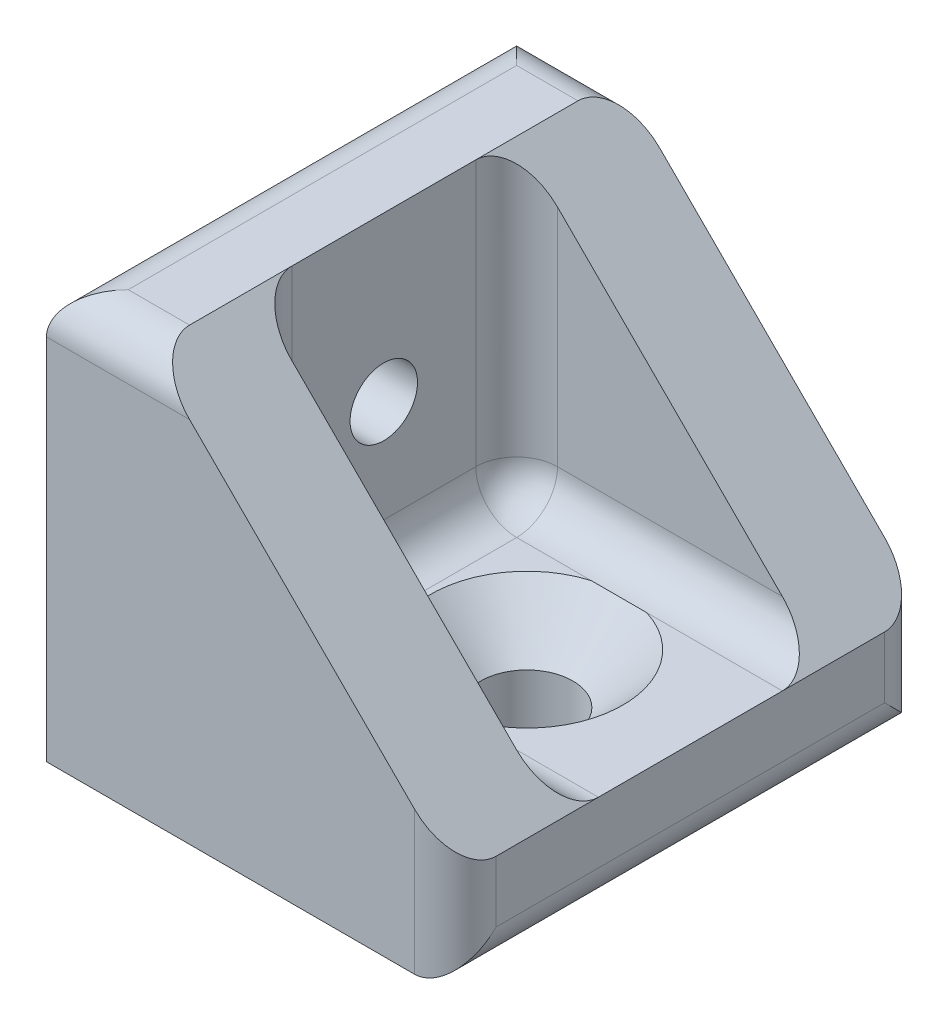
from build123d import *

# Parameters (mm, degrees)
BOSS_EXTRUDE2_DEPTH         = 23
SHELL1_START                = 5
SHELL1_OUTLINE_W            = 16
SHELL1_OUTLINE_H            = 13
SHELL1_DEPTH                = 15
FILLET1_R                   = 2
FILLET3_R                   = 2
TAP_DRILL_FOR_M4X0_7_TAP1_D = 3.3


# Read off the part's stored shape, not the designer's step: Shell1
with BuildPart() as part:
    # Sketch1 → Boss-Extrude2 (new body)
    with BuildSketch(Plane.XY):
        Polygon((0, 0), (0, 20), (5, 20), (20, 5), (20, 0), align=None)
    extrude(amount=-BOSS_EXTRUDE2_DEPTH)

    # Shell1 outline → Shell1 (cut)
    with BuildSketch(Plane(origin=(0, 0, 0), x_dir=(1, 0, 0), z_dir=(0, 1, 0)).offset(SHELL1_START)):
        with Locations((13, 11.5)):
            Rectangle(SHELL1_OUTLINE_W, SHELL1_OUTLINE_H)
    extrude(amount=SHELL1_DEPTH, mode=Mode.SUBTRACT)

    # Fillet1
    fillet1_edges = [part.edges().sort_by_distance(p)[0] for p in [
        (12.5, 5, -18),
        (5, 12.5, -18),
        (5, 5, -11.5),
        (12.5, 5, -5),
        (5, 12.5, -5),
    ]]
    fillet(fillet1_edges, radius=FILLET1_R)

    # Fillet3
    fillet3_edges = [part.edges().sort_by_distance(p)[0] for p in [
        (2.5, 20, -23),
        (2.5, 20, 0),
        (20, 2.5, 0),
        (20, 2.5, -23),
        (0, 20, -11.5),
        (20, 0, -11.5),
    ]]
    fillet(fillet3_edges, radius=FILLET3_R)

    # Tap Drill for M4x0.7 Tap1 (through all)
    with Locations(Plane(origin=(5, 12, -11.5), x_dir=(0, 0, 1), z_dir=(1, 0, 0))):
        with Locations((0, 0)):
            Hole(TAP_DRILL_FOR_M4X0_7_TAP1_D / 2)

    # Sketch9 → CSK for M4 Flat Head Machine Screw2 (revolve, cut)
    with BuildSketch(Plane(origin=(12, 5, -11.5), x_dir=(0, 0, 1), z_dir=(1, 0, 0))):
        Polygon((0, 0), (0, 5), (2.25, 5), (2.25, 2.45), (4.7, 0), align=None)
    revolve(axis=Axis((12, 11.35, -11.5), (0, -1, 0)), mode=Mode.SUBTRACT)


solid = part.part
